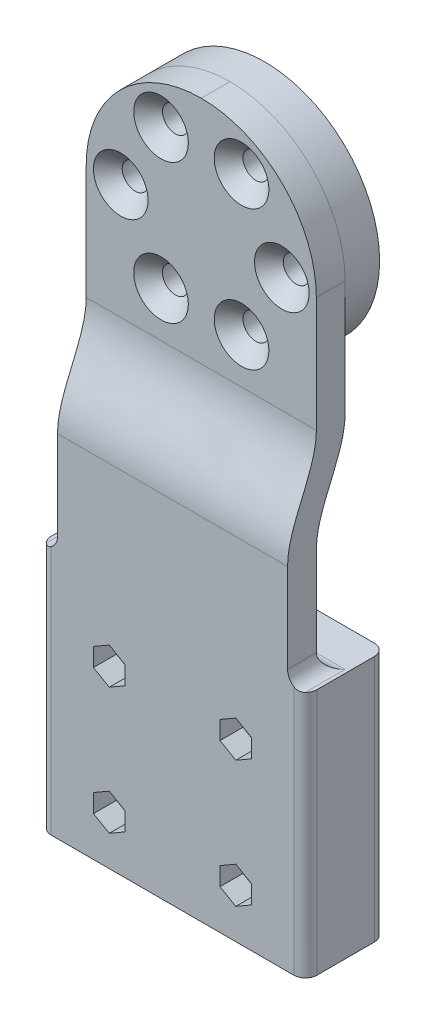
from build123d import *

# Parameters (mm, degrees)
SKETCH7_W           = 40
SKETCH7_H           = 40
BOSS_EXTRUDE1_DEPTH = 11
LOFT1_START         = -20
LOFT1_DEPTH         = 40
SKETCH16_W          = 49.026286786
SKETCH16_H          = 65.242270374
SKETCH16_R          = 20
CUT_EXTRUDE3_DEPTH  = 6
SKETCH17_W          = 40
SKETCH17_H          = 5
BOSS_EXTRUDE5_DEPTH = 18
SKETCH10_R          = 2.25
CUT_EXTRUDE1_DEPTH  = 25
CHAMFER1_SIZE       = 2.5
FILLET3_R           = 20
SKETCH11_W          = 46.2
SKETCH11_H          = 14
BOSS_EXTRUDE6_DEPTH = 43
FILLET9_R           = 2.5
SKETCH20_W          = 40.6
SKETCH20_H          = 4.4
CUT_EXTRUDE4_DEPTH  = 40
SKETCH22_R          = 1.7
CUT_EXTRUDE5_DEPTH  = 30
FILLET11_R          = 2
CUT_EXTRUDE6_DEPTH  = 4
SKETCH24_R          = 3
CUT_EXTRUDE7_DEPTH  = 3


# Read off the part's stored shape, not the designer's step: Loft1
with BuildPart() as part:
    # Sketch7 → Boss-Extrude1 (new body)
    with BuildSketch(Plane.XY):
        Rectangle(SKETCH7_W, SKETCH7_H)
    extrude(amount=BOSS_EXTRUDE1_DEPTH)

    # Loft1 outline → Loft1 (add)
    with BuildSketch(Plane.YZ.offset(LOFT1_START)):
        with BuildLine():
            add(Edge.make_bspline(
                [(-38, 16), (-31.772819436, 16), (-26.227180564, 11), (-20, 11)],
                knots=[0, 0, 0, 0, 1, 1, 1, 1], degree=3))
            Line((-38, 16), (-38, 11))
            add(Edge.make_bspline(
                [(-38, 11), (-31.772819436, 11), (-26.227180564, 6), (-20, 6)],
                knots=[0, 0, 0, 0, 1, 1, 1, 1], degree=3))
            Line((-20, 6), (-20, 11))
        make_face()
    extrude(amount=LOFT1_DEPTH)

    # Sketch16 → Cut-Extrude3 (cut)
    with BuildSketch(Plane(origin=(0, 0, 0), x_dir=(-1, 0, 0), z_dir=(0, 0, -1))):
        Rectangle(SKETCH16_W, SKETCH16_H)
        Circle(SKETCH16_R, mode=Mode.SUBTRACT)
    extrude(amount=-CUT_EXTRUDE3_DEPTH, mode=Mode.SUBTRACT)

    # Sketch17 → Boss-Extrude5 (add)
    with BuildSketch(Plane(origin=(0, -38, 0), x_dir=(-1, 0, 0), z_dir=(0, -1, 0))):
        with Locations((0, -13.5)):
            Rectangle(SKETCH17_W, SKETCH17_H)
    extrude(amount=BOSS_EXTRUDE5_DEPTH)

    # Sketch10 → Cut-Extrude1 (cut)
    with BuildSketch(Plane.XY.offset(11)):
        with Locations((-7.00009521, 12.124420806)):
            Circle(SKETCH10_R)
        with Locations((6.99990479, 12.124420806)):
            Circle(SKETCH10_R)
        with Locations((13.99990479, 6.5153e-05)):
            Circle(SKETCH10_R)
        with Locations((6.99990479, -12.1242905)):
            Circle(SKETCH10_R)
        with Locations((-7.00009521, -12.1242905)):
            Circle(SKETCH10_R)
        with Locations((-14.00009521, 6.5153e-05)):
            Circle(SKETCH10_R)
    extrude(amount=-CUT_EXTRUDE1_DEPTH, mode=Mode.SUBTRACT)

    # Chamfer1
    chamfer1_edges = [part.edges().sort_by_distance(p)[0] for p in [
        (4.74990479, 12.124420806, 11),
        (-9.25009521, 12.124420806, 11),
        (-16.25009521, 6.5153e-05, 11),
        (-9.25009521, -12.1242905, 11),
        (4.74990479, -12.1242905, 11),
        (11.74990479, 6.5153e-05, 11),
    ]]
    chamfer(chamfer1_edges, length=CHAMFER1_SIZE)

    # Fillet3
    fillet3_edges = [part.edges().sort_by_distance(p)[0] for p in [
        (20, 20, 8.5),
        (-20, 20, 8.5),
    ]]
    fillet(fillet3_edges, radius=FILLET3_R - 0.0001)  # a hair under: the kernel refuses the full size

    # Sketch11 → Boss-Extrude6 (add)
    with BuildSketch(Plane(origin=(0, -56, -3.472963553), x_dir=(1, 0, 0), z_dir=(0, 1, 0))):
        with Locations((0, -12.472963553)):
            Rectangle(SKETCH11_W, SKETCH11_H)
    extrude(amount=-BOSS_EXTRUDE6_DEPTH)

    # Fillet9
    fillet9_edges = [part.edges().sort_by_distance(p)[0] for p in [
        (0, -56, 11),
        (-20, -56, 13.5),
        (20, -56, 13.5),
    ]]
    fillet(fillet9_edges, radius=FILLET9_R)

    # Sketch20 → Cut-Extrude4 (cut)
    with BuildSketch(Plane.XZ.offset(99)):
        with Locations((0, 9)):
            Rectangle(SKETCH20_W, SKETCH20_H)
    extrude(amount=-CUT_EXTRUDE4_DEPTH, mode=Mode.SUBTRACT)

    # Sketch22 → Cut-Extrude5 (cut)
    with BuildSketch(Plane.XY):
        with Locations(Location((11, -68.5, 0), (0, 0, 180))):
            Circle(SKETCH22_R)
        with Locations(Location((11, -90.5, 0), (0, 0, 180))):
            Circle(SKETCH22_R)
        with Locations(Location((-11, -90.5, 0), (0, 0, 180))):
            Circle(SKETCH22_R)
        with Locations(Location((-11, -68.5, 0), (0, 0, 180))):
            Circle(SKETCH22_R)
    extrude(amount=CUT_EXTRUDE5_DEPTH, mode=Mode.SUBTRACT)

    # Fillet11
    fillet11_edges = [part.edges().sort_by_distance(p)[0] for p in [
        (-23.1, -77.5, 16),
        (-23.1, -77.5, 2),
        (23.1, -77.5, 16),
        (23.1, -77.5, 2),
    ]]
    fillet(fillet11_edges, radius=FILLET11_R)

    # Sketch23 → Cut-Extrude6 (cut)
    with BuildSketch(Plane.XY.offset(16)):
        Polygon((-11, -65.324573519), (-13.75, -66.91228676), (-13.75, -70.08771324), (-11, -71.675426481), (-8.25, -70.08771324), (-8.25, -66.91228676), align=None)
        Polygon((11, -65.324573519), (8.25, -66.91228676), (8.25, -70.08771324), (11, -71.675426481), (13.75, -70.08771324), (13.75, -66.91228676), align=None)
        Polygon((11, -87.324573519), (8.25, -88.91228676), (8.25, -92.08771324), (11, -93.675426481), (13.75, -92.08771324), (13.75, -88.91228676), align=None)
        Polygon((-11, -87.324573519), (-13.75, -88.91228676), (-13.75, -92.08771324), (-11, -93.675426481), (-8.25, -92.08771324), (-8.25, -88.91228676), align=None)
    extrude(amount=-CUT_EXTRUDE6_DEPTH, mode=Mode.SUBTRACT)

    # Sketch24 → Cut-Extrude7 (cut)
    with BuildSketch(Plane(origin=(0, 0, 2), x_dir=(-1, 0, 0), z_dir=(0, 0, -1))):
        with Locations((-11, -68.5)):
            Circle(SKETCH24_R)
        with Locations((11, -68.5)):
            Circle(SKETCH24_R)
        with Locations((11, -90.5)):
            Circle(SKETCH24_R)
        with Locations((-11, -90.5)):
            Circle(SKETCH24_R)
    extrude(amount=-CUT_EXTRUDE7_DEPTH, mode=Mode.SUBTRACT)


solid = part.part
